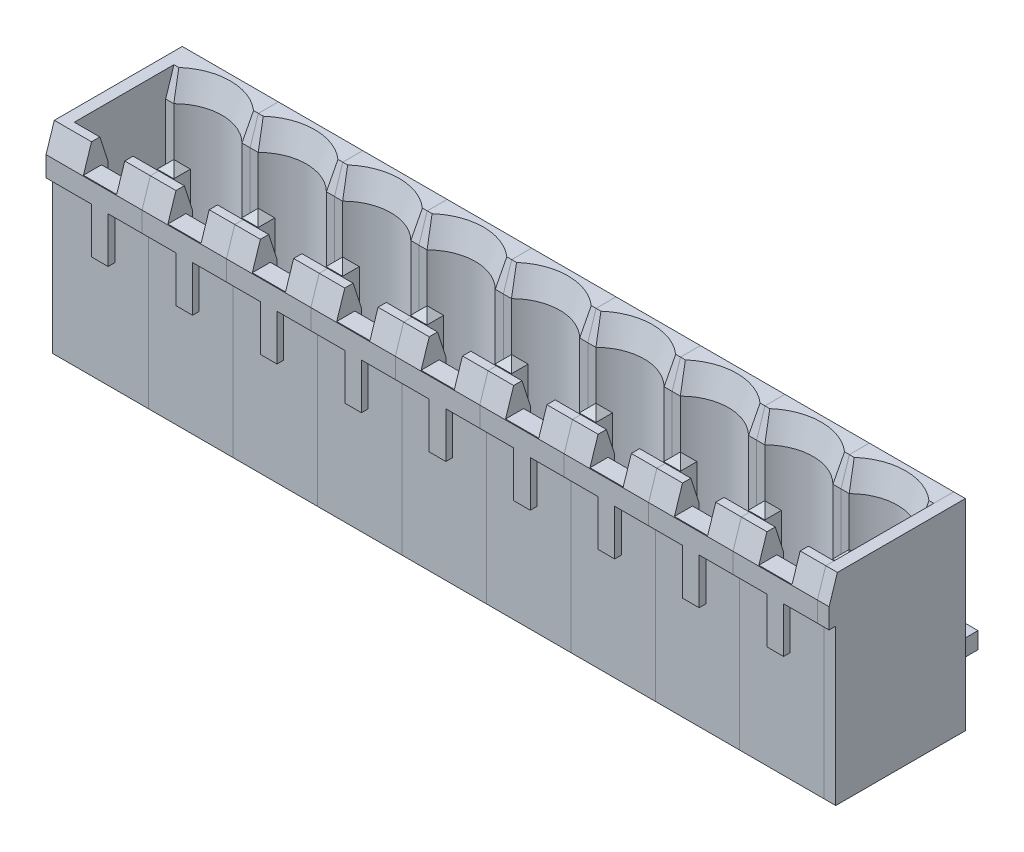
from build123d import *
from OCP.BRepFilletAPI import BRepFilletAPI_MakeChamfer

# Parameters (mm, degrees)
SKETCH_1_W             = 5.08
SKETCH_1_H             = 12.1
EXTRUDE_1_DEPTH        = 8.2
CUT_EXTRUDE_1_DEPTH    = 8.7
SKETCH_3_R             = 1.2
EXTRUDE_2_DEPTH        = 2
FILLET_1_R             = 0.25
CHAMFER_1_SIZE         = 0.5
CHAMFER_1_SIZE2        = 1.538841769
SKETCH_4_W             = 2
SKETCH_4_H             = 1.010953213
CUT_EXTRUDE_2_DEPTH    = 4.75
SKETCH_5_W             = 2
SKETCH_5_H             = 1.705458635
CUT_EXTRUDE_3_DEPTH    = 1.5
CHAMFER_2_SIZE         = 0.5
CHAMFER_2_SIZE2        = 1.538841769
SKETCH_6_W             = 5.08
SKETCH_6_H             = 6.6
CUT_EXTRUDE_4_DEPTH    = 0.4
SKETCH_7_W             = 2.04
SKETCH_7_H             = 2.75
CUT_EXTRUDE_5_DEPTH    = 0.4
EXTRUDE_1_2_DEPTH      = 0.5
EXTRUDE_1_2_DEPTH_BACK = 0.5
CHAMFER_3_SIZE         = 0.5
SKETCH_9_W             = 1
SKETCH_9_H             = 2.1
SKETCH_9_W_2           = 1.04
CUT_EXTRUDE_6_DEPTH    = 6
PATTERN_LINEAR_1_COUNT = 9
PATTERN_LINEAR_1_PITCH = 5.08
EXTRUDE_3_DEPTH        = 0.7
EXTRUDE_4_DEPTH        = 0.7
MOVE_BODY_1_ANGLE      = 180


with BuildPart() as part:
    # Эскиз1 → Extrude 1 (new body)
    with BuildSketch(Plane(origin=(0, 0, 0), x_dir=(1, 0, 0), z_dir=(0, 1, 0))):
        Rectangle(SKETCH_1_W, SKETCH_1_H)
    extrude(amount=EXTRUDE_1_DEPTH)

    # Эскиз2 → Вырез-Вытянуть1 (cut)
    with BuildSketch(Plane.XY.offset(6.05)):
        with BuildLine():
            Line((-2.54, 6.7), (2.54, 6.7))
            Line((2.54, 6.7), (2.54, 1.7))
            Line((2.54, 1.7), (2.05121915, 1.7))
            ThreePointArc((2.05121915, 1.7), (0, 0.85), (-2.05121915, 1.7))
            Line((-2.05121915, 1.7), (-2.54, 1.7))
            Line((-2.54, 1.7), (-2.54, 6.7))
        make_face()
    extrude(amount=-CUT_EXTRUDE_1_DEPTH, mode=Mode.SUBTRACT)

    # Эскиз3 → Бобышка-Вытянуть2 (add)
    with BuildSketch(Plane.XY.offset(-2.65)):
        with Locations((0, 3.75)):
            Circle(SKETCH_3_R)
    extrude(amount=EXTRUDE_2_DEPTH)

    # Скругление1
    fillet_1_edges = [part.edges().sort_by_distance(p)[0] for p in [
        (-1.2, 3.75, -0.65),
    ]]
    fillet(fillet_1_edges, radius=FILLET_1_R)

    # Фаска1: one chamfer whose edges measure the first distance from different faces: ONE call of the kernel's chamfer builder (chamfer() names one face for all edges)
    chamfer_1_edges_1 = [part.edges().sort_by_distance(p)[0] for p in [
        (0, 6.7, 6.05),
    ]]
    chamfer_1_side_1 = [part.faces().sort_by_distance(p)[0] for p in [
        (0, 7.45, 6.05),
    ]]
    chamfer_1_edges_2 = [part.edges().sort_by_distance(p)[0] for p in [
        (2.295609575, 1.7, 6.05),
        (-2.295609575, 1.7, 6.05),
        (0, 0.85, 6.05),
    ]]
    chamfer_1_side_2 = [part.faces().sort_by_distance(p)[0] for p in [
        (0, 0.655214235, 6.05),
    ]]
    chamfer_1 = BRepFilletAPI_MakeChamfer(part.part.solid().wrapped)
    for e in chamfer_1_edges_1:
        chamfer_1.Add(CHAMFER_1_SIZE, CHAMFER_1_SIZE2, e.wrapped, chamfer_1_side_1[0].wrapped)  # the first distance lies on this face
    for e in chamfer_1_edges_2:
        chamfer_1.Add(CHAMFER_1_SIZE, CHAMFER_1_SIZE2, e.wrapped, chamfer_1_side_2[0].wrapped)  # the first distance lies on this face
    add(Compound.cast(chamfer_1.Shape()), mode=Mode.REPLACE)

    # Эскиз4 → Вырез-Вытянуть2 (cut)
    with BuildSketch(Plane.XY.offset(6.05)):
        with Locations((0, 6.594523394)):
            Rectangle(SKETCH_4_W, SKETCH_4_H)
    extrude(amount=-CUT_EXTRUDE_2_DEPTH, mode=Mode.SUBTRACT)

    # Эскиз5 → Вырез-Вытянуть3 (cut)
    with BuildSketch(Plane.XY.offset(6.05)):
        with Locations((0, 7.552729318)):
            Rectangle(SKETCH_5_W, SKETCH_5_H)
    extrude(amount=-CUT_EXTRUDE_3_DEPTH, mode=Mode.SUBTRACT)

    # Фаска2
    chamfer_2_edges = [part.edges().sort_by_distance(p)[0] for p in [
        (-1.77, 8.2, 6.05),
    ]]
    chamfer_2_side = [part.faces().sort_by_distance(p)[0] for p in [
        (-1.77, 7.7, 6.05),
    ]]
    chamfer(chamfer_2_edges, length=CHAMFER_2_SIZE, length2=CHAMFER_2_SIZE2, reference=chamfer_2_side[0])

    # Эскиз6 → Вырез-Вытянуть4 (cut)
    with BuildSketch(Plane(origin=(0, 8.2, 0), x_dir=(1, 0, 0), z_dir=(0, 1, 0))):
        with Locations((0, 2.75)):
            Rectangle(SKETCH_6_W, SKETCH_6_H)
    extrude(amount=-CUT_EXTRUDE_4_DEPTH, mode=Mode.SUBTRACT)

    # Эскиз7 → Вырез-Вытянуть5 (cut)
    with BuildSketch(Plane(origin=(0, 8.2, 0), x_dir=(1, 0, 0), z_dir=(0, 1, 0))):
        with Locations((1.52, -1.925)):
            Rectangle(SKETCH_7_W, SKETCH_7_H)
        with Locations((-1.52, -1.925)):
            Rectangle(SKETCH_7_W, SKETCH_7_H)
    extrude(amount=-CUT_EXTRUDE_5_DEPTH, mode=Mode.SUBTRACT)

    # Эскиз9 → Вырез-Вытянуть6 (cut)
    with BuildSketch(Plane.XZ):
        with Locations((0, -5)):
            Rectangle(SKETCH_9_W, SKETCH_9_H)
        with Locations((-2.02, -5)):
            Rectangle(SKETCH_9_W_2, SKETCH_9_H)
        with Locations((2.02, -5)):
            Rectangle(SKETCH_9_W_2, SKETCH_9_H)
    extrude(amount=-CUT_EXTRUDE_6_DEPTH, mode=Mode.SUBTRACT)


with BuildPart() as body_2:
    # Эскиз8 → Extrude 1 2 (new, two sides: drawn at the far end of the back side and taken through both)
    with BuildSketch(Plane(origin=(0, 0, 0), x_dir=(0, 0, -1), z_dir=(1, 0, 0)).offset(-EXTRUDE_1_2_DEPTH_BACK)):
        with BuildLine():
            Line((-3.65, 3.25), (3.95, 3.25))
            Line((3.95, 3.25), (3.95, -4))
            Line((3.95, -4), (4.95, -4))
            Line((4.95, -4), (4.95, 3.25))
            ThreePointArc((4.95, 3.25), (4.657106781, 3.957106781), (3.95, 4.25))
            Line((3.95, 4.25), (-3.65, 4.25))
            Line((-3.65, 4.25), (-3.65, 3.25))
        make_face()
    extrude(amount=EXTRUDE_1_2_DEPTH + EXTRUDE_1_2_DEPTH_BACK)

    # Фаска3
    chamfer_3_edges = [body_2.edges().sort_by_distance(p)[0] for p in [
        (0, 3.25, 3.65),
        (0, 4.25, 3.65),
        (0, -4, -4.95),
        (0, -4, -3.95),
        (0.5, -4, -4.45),
        (0.5, 3.75, 3.65),
        (-0.5, 3.75, 3.65),
        (-0.5, -4, -4.45),
    ]]
    chamfer(chamfer_3_edges, length=CHAMFER_3_SIZE - 0.0001)  # a hair under: the kernel refuses the full size


with BuildPart() as pattern_linear_1_1:
    # Линейный массив1: pattern copy
    add(part.part.moved(Location(Vector(-1, 0, 0) * (1 * PATTERN_LINEAR_1_PITCH))))


with BuildPart() as pattern_linear_1_2:
    # Линейный массив1: pattern copy
    add(part.part.moved(Location(Vector(-1, 0, 0) * (2 * PATTERN_LINEAR_1_PITCH))))


with BuildPart() as pattern_linear_1_3:
    # Линейный массив1: pattern copy
    add(part.part.moved(Location(Vector(-1, 0, 0) * (3 * PATTERN_LINEAR_1_PITCH))))


with BuildPart() as pattern_linear_1_4:
    # Линейный массив1: pattern copy
    add(part.part.moved(Location(Vector(-1, 0, 0) * (4 * PATTERN_LINEAR_1_PITCH))))


with BuildPart() as pattern_linear_1_5:
    # Линейный массив1: pattern copy
    add(part.part.moved(Location(Vector(-1, 0, 0) * (5 * PATTERN_LINEAR_1_PITCH))))


with BuildPart() as pattern_linear_1_6:
    # Линейный массив1: pattern copy
    add(part.part.moved(Location(Vector(-1, 0, 0) * (6 * PATTERN_LINEAR_1_PITCH))))


with BuildPart() as pattern_linear_1_7:
    # Линейный массив1: pattern copy
    add(part.part.moved(Location(Vector(-1, 0, 0) * (7 * PATTERN_LINEAR_1_PITCH))))


with BuildPart() as pattern_linear_1_8:
    # Линейный массив1: pattern copy
    add(part.part.moved(Location(Vector(-1, 0, 0) * (8 * PATTERN_LINEAR_1_PITCH))))


with BuildPart() as pattern_linear_1_9:
    # Линейный массив1: pattern copy
    add(body_2.part.moved(Location(Vector(-1, 0, 0) * (1 * PATTERN_LINEAR_1_PITCH))))


with BuildPart() as pattern_linear_1_10:
    # Линейный массив1: pattern copy
    add(body_2.part.moved(Location(Vector(-1, 0, 0) * (2 * PATTERN_LINEAR_1_PITCH))))


with BuildPart() as pattern_linear_1_11:
    # Линейный массив1: pattern copy
    add(body_2.part.moved(Location(Vector(-1, 0, 0) * (3 * PATTERN_LINEAR_1_PITCH))))


with BuildPart() as pattern_linear_1_12:
    # Линейный массив1: pattern copy
    add(body_2.part.moved(Location(Vector(-1, 0, 0) * (4 * PATTERN_LINEAR_1_PITCH))))


with BuildPart() as pattern_linear_1_13:
    # Линейный массив1: pattern copy
    add(body_2.part.moved(Location(Vector(-1, 0, 0) * (5 * PATTERN_LINEAR_1_PITCH))))


with BuildPart() as pattern_linear_1_14:
    # Линейный массив1: pattern copy
    add(body_2.part.moved(Location(Vector(-1, 0, 0) * (6 * PATTERN_LINEAR_1_PITCH))))


with BuildPart() as pattern_linear_1_15:
    # Линейный массив1: pattern copy
    add(body_2.part.moved(Location(Vector(-1, 0, 0) * (7 * PATTERN_LINEAR_1_PITCH))))


with BuildPart() as pattern_linear_1_16:
    # Линейный массив1: pattern copy
    add(body_2.part.moved(Location(Vector(-1, 0, 0) * (8 * PATTERN_LINEAR_1_PITCH))))


with BuildPart() as part_1:
    add(part.part)

    # Эскиз10 → Бобышка-Вытянуть3 (add)
    with BuildSketch(Plane(origin=(2.54, 0, 0), x_dir=(0, 0, -1), z_dir=(1, 0, 0))):
        Polygon((6.05, 7.8), (-3.3, 7.8), (-3.3, 8.2), (-4.511158231, 8.2), (-6.05, 7.7), (-6.05, 0), (6.05, 0), align=None)
    extrude(amount=EXTRUDE_3_DEPTH)


with BuildPart() as body_19:
    # Эскиз11 → Бобышка-Вытянуть4 (new body)
    with BuildSketch(Plane.ZY.offset(43.18)):
        Polygon((-6.05, 7.8), (-6.05, 0), (6.05, 0), (6.05, 7.7), (4.511158231, 8.2), (3.3, 8.2), (3.3, 7.8), align=None)
    extrude(amount=EXTRUDE_4_DEPTH)


with BuildPart() as body_2_1:
    # Move Body 1: moved
    add(body_2.part.rotate(Axis((0, 0, 0), (0, 0.7071067811865488, 0.7071067811865462)), MOVE_BODY_1_ANGLE))


with BuildPart() as pattern_linear_1_9_1:
    # Move Body 1: moved
    add(pattern_linear_1_9.part.rotate(Axis((0, 0, 0), (0, 0.7071067811865488, 0.7071067811865462)), MOVE_BODY_1_ANGLE))


with BuildPart() as pattern_linear_1_1_1:
    # Move Body 1: moved
    add(pattern_linear_1_1.part.rotate(Axis((0, 0, 0), (0, 0.7071067811865488, 0.7071067811865462)), MOVE_BODY_1_ANGLE))


with BuildPart() as pattern_linear_1_2_1:
    # Move Body 1: moved
    add(pattern_linear_1_2.part.rotate(Axis((0, 0, 0), (0, 0.7071067811865488, 0.7071067811865462)), MOVE_BODY_1_ANGLE))


with BuildPart() as pattern_linear_1_3_1:
    # Move Body 1: moved
    add(pattern_linear_1_3.part.rotate(Axis((0, 0, 0), (0, 0.7071067811865488, 0.7071067811865462)), MOVE_BODY_1_ANGLE))


with BuildPart() as pattern_linear_1_10_1:
    # Move Body 1: moved
    add(pattern_linear_1_10.part.rotate(Axis((0, 0, 0), (0, 0.7071067811865488, 0.7071067811865462)), MOVE_BODY_1_ANGLE))


with BuildPart() as pattern_linear_1_11_1:
    # Move Body 1: moved
    add(pattern_linear_1_11.part.rotate(Axis((0, 0, 0), (0, 0.7071067811865488, 0.7071067811865462)), MOVE_BODY_1_ANGLE))


with BuildPart() as pattern_linear_1_12_1:
    # Move Body 1: moved
    add(pattern_linear_1_12.part.rotate(Axis((0, 0, 0), (0, 0.7071067811865488, 0.7071067811865462)), MOVE_BODY_1_ANGLE))


with BuildPart() as pattern_linear_1_13_1:
    # Move Body 1: moved
    add(pattern_linear_1_13.part.rotate(Axis((0, 0, 0), (0, 0.7071067811865488, 0.7071067811865462)), MOVE_BODY_1_ANGLE))


with BuildPart() as pattern_linear_1_14_1:
    # Move Body 1: moved
    add(pattern_linear_1_14.part.rotate(Axis((0, 0, 0), (0, 0.7071067811865488, 0.7071067811865462)), MOVE_BODY_1_ANGLE))


with BuildPart() as pattern_linear_1_15_1:
    # Move Body 1: moved
    add(pattern_linear_1_15.part.rotate(Axis((0, 0, 0), (0, 0.7071067811865488, 0.7071067811865462)), MOVE_BODY_1_ANGLE))


with BuildPart() as pattern_linear_1_16_1:
    # Move Body 1: moved
    add(pattern_linear_1_16.part.rotate(Axis((0, 0, 0), (0, 0.7071067811865488, 0.7071067811865462)), MOVE_BODY_1_ANGLE))


with BuildPart() as pattern_linear_1_4_1:
    # Move Body 1: moved
    add(pattern_linear_1_4.part.rotate(Axis((0, 0, 0), (0, 0.7071067811865488, 0.7071067811865462)), MOVE_BODY_1_ANGLE))


with BuildPart() as pattern_linear_1_5_1:
    # Move Body 1: moved
    add(pattern_linear_1_5.part.rotate(Axis((0, 0, 0), (0, 0.7071067811865488, 0.7071067811865462)), MOVE_BODY_1_ANGLE))


with BuildPart() as pattern_linear_1_6_1:
    # Move Body 1: moved
    add(pattern_linear_1_6.part.rotate(Axis((0, 0, 0), (0, 0.7071067811865488, 0.7071067811865462)), MOVE_BODY_1_ANGLE))


with BuildPart() as pattern_linear_1_7_1:
    # Move Body 1: moved
    add(pattern_linear_1_7.part.rotate(Axis((0, 0, 0), (0, 0.7071067811865488, 0.7071067811865462)), MOVE_BODY_1_ANGLE))


with BuildPart() as pattern_linear_1_8_1:
    # Move Body 1: moved
    add(pattern_linear_1_8.part.rotate(Axis((0, 0, 0), (0, 0.7071067811865488, 0.7071067811865462)), MOVE_BODY_1_ANGLE))


with BuildPart() as part_2:
    # Move Body 1: moved
    add(part_1.part.rotate(Axis((0, 0, 0), (0, 0.7071067811865488, 0.7071067811865462)), MOVE_BODY_1_ANGLE))


with BuildPart() as body_19_1:
    # Move Body 1: moved
    add(body_19.part.rotate(Axis((0, 0, 0), (0, 0.7071067811865488, 0.7071067811865462)), MOVE_BODY_1_ANGLE))


with BuildPart() as body_19_2:
    # Mate 1: read off the stored shape, not the designer's step
    # Mate 1: moved
    add(body_19_1.part.moved(Location((0, 4.45, 0))))


with BuildPart() as part_3:
    # Mate 1 2: moved
    add(part_2.part.moved(Location((0, 4.45, 0))))


with BuildPart() as pattern_linear_1_8_2:
    # Mate 1 3: moved
    add(pattern_linear_1_8_1.part.moved(Location((0, 4.45, 0))))


with BuildPart() as pattern_linear_1_7_2:
    # Mate 1 4: moved
    add(pattern_linear_1_7_1.part.moved(Location((0, 4.45, 0))))


with BuildPart() as pattern_linear_1_6_2:
    # Mate 1 5: moved
    add(pattern_linear_1_6_1.part.moved(Location((0, 4.45, 0))))


with BuildPart() as pattern_linear_1_5_2:
    # Mate 1 6: moved
    add(pattern_linear_1_5_1.part.moved(Location((0, 4.45, 0))))


with BuildPart() as pattern_linear_1_4_2:
    # Mate 1 7: moved
    add(pattern_linear_1_4_1.part.moved(Location((0, 4.45, 0))))


with BuildPart() as pattern_linear_1_16_2:
    # Mate 1 8: moved
    add(pattern_linear_1_16_1.part.moved(Location((0, 4.45, 0))))


with BuildPart() as pattern_linear_1_15_2:
    # Mate 1 9: moved
    add(pattern_linear_1_15_1.part.moved(Location((0, 4.45, 0))))


with BuildPart() as pattern_linear_1_14_2:
    # Mate 1 10: moved
    add(pattern_linear_1_14_1.part.moved(Location((0, 4.45, 0))))


with BuildPart() as pattern_linear_1_13_2:
    # Mate 1 11: moved
    add(pattern_linear_1_13_1.part.moved(Location((0, 4.45, 0))))


with BuildPart() as pattern_linear_1_12_2:
    # Mate 1 12: moved
    add(pattern_linear_1_12_1.part.moved(Location((0, 4.45, 0))))


with BuildPart() as pattern_linear_1_11_2:
    # Mate 1 13: moved
    add(pattern_linear_1_11_1.part.moved(Location((0, 4.45, 0))))


with BuildPart() as pattern_linear_1_10_2:
    # Mate 1 14: moved
    add(pattern_linear_1_10_1.part.moved(Location((0, 4.45, 0))))


with BuildPart() as pattern_linear_1_3_2:
    # Mate 1 15: moved
    add(pattern_linear_1_3_1.part.moved(Location((0, 4.45, 0))))


with BuildPart() as pattern_linear_1_2_2:
    # Mate 1 16: moved
    add(pattern_linear_1_2_1.part.moved(Location((0, 4.45, 0))))


with BuildPart() as pattern_linear_1_1_2:
    # Mate 1 17: moved
    add(pattern_linear_1_1_1.part.moved(Location((0, 4.45, 0))))


with BuildPart() as pattern_linear_1_9_2:
    # Mate 1 18: moved
    add(pattern_linear_1_9_1.part.moved(Location((0, 4.45, 0))))


with BuildPart() as body_2_2:
    # Mate 1 19: moved
    add(body_2_1.part.moved(Location((0, 4.45, 0))))


solid = Compound([body_19_2.part, part_3.part, pattern_linear_1_8_2.part, pattern_linear_1_7_2.part, pattern_linear_1_6_2.part, pattern_linear_1_5_2.part, pattern_linear_1_4_2.part, pattern_linear_1_16_2.part, pattern_linear_1_15_2.part, pattern_linear_1_14_2.part, pattern_linear_1_13_2.part, pattern_linear_1_12_2.part, pattern_linear_1_11_2.part, pattern_linear_1_10_2.part, pattern_linear_1_3_2.part, pattern_linear_1_2_2.part, pattern_linear_1_1_2.part, pattern_linear_1_9_2.part, body_2_2.part])
